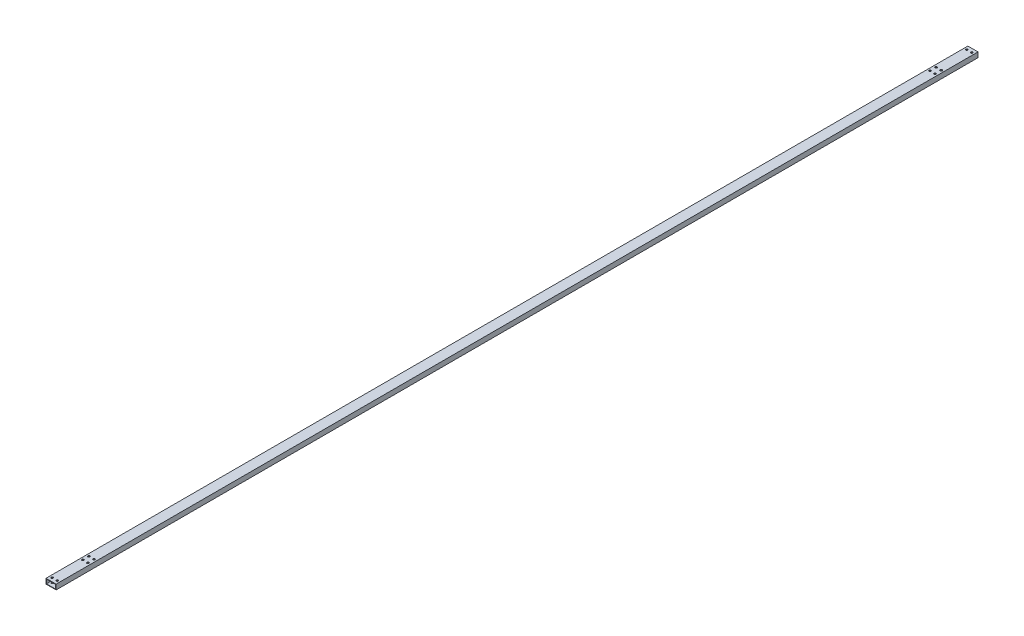
from build123d import *

# Parameters (mm, degrees)
SKETCH_1_W          = 20
SKETCH_1_H          = 10
SKETCH_1_W_2        = 18
SKETCH_1_H_2        = 8
EXTRUDE_1_DEPTH     = 1820
SKETCH_3_R          = 2
CUT_EXTRUDE_2_DEPTH = 1821.137357454


with BuildPart() as part:
    # 草图1 → 凸台-拉伸1 (new body)
    with BuildSketch(Plane.XY):
        with Locations((10, 5)):
            Rectangle(SKETCH_1_W, SKETCH_1_H)
        with Locations((10, 5)):
            Rectangle(SKETCH_1_W_2, SKETCH_1_H_2, mode=Mode.SUBTRACT)
    extrude(amount=EXTRUDE_1_DEPTH)

    # 草图3 → 切除-拉伸2 (cut, through all)
    with BuildSketch(Plane.XZ):
        with Locations((5, 1812.8)):
            Circle(SKETCH_3_R)
        with Locations((15, 1812.8)):
            Circle(SKETCH_3_R)
        with Locations((15, 1752.2)):
            Circle(SKETCH_3_R)
        with Locations((15, 1740.2)):
            Circle(SKETCH_3_R)
        with Locations((5, 1740.2)):
            Circle(SKETCH_3_R)
        with Locations((5, 1752.2)):
            Circle(SKETCH_3_R)
        with Locations((5, 7.2)):
            Circle(SKETCH_3_R)
        with Locations((15, 7.2)):
            Circle(SKETCH_3_R)
        with Locations((15, 67.8)):
            Circle(SKETCH_3_R)
        with Locations((15, 79.8)):
            Circle(SKETCH_3_R)
        with Locations((5, 79.8)):
            Circle(SKETCH_3_R)
        with Locations((5, 67.8)):
            Circle(SKETCH_3_R)
    extrude(amount=-CUT_EXTRUDE_2_DEPTH, mode=Mode.SUBTRACT)


solid = part.part
